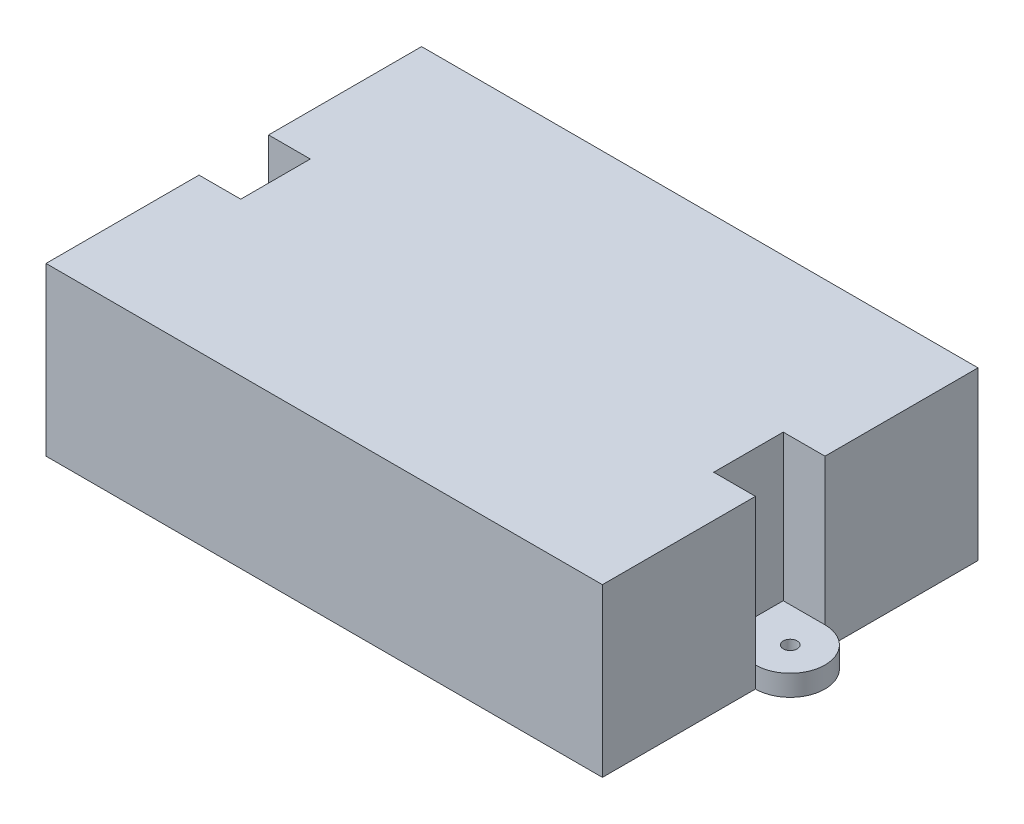
from build123d import *

# Parameters (mm, degrees)
SKETCH1_R           = 1
BOSS_EXTRUDE1_DEPTH = 3
BOSS_EXTRUDE2_DEPTH = 21


with BuildPart() as part:
    # Sketch1 → Boss-Extrude1 (new body)
    with BuildSketch(Plane(origin=(0, 0, 0), x_dir=(1, 0, 0), z_dir=(0, 1, 0))):
        with BuildLine():
            Line((-40, 5), (-40, 27))
            Line((-40, 27), (40, 27))
            Line((40, 27), (40, 5))
            ThreePointArc((40, 5), (45, 0), (40, -5))
            Line((40, -5), (40, -27))
            Line((40, -27), (-40, -27))
            Line((-40, -27), (-40, -5))
            ThreePointArc((-40, -5), (-45, 0), (-40, 5))
        make_face()
        with Locations((-40, 0)):
            Circle(SKETCH1_R, mode=Mode.SUBTRACT)
        with Locations((40, 0)):
            Circle(SKETCH1_R, mode=Mode.SUBTRACT)
    extrude(amount=BOSS_EXTRUDE1_DEPTH)

    # Sketch2 → Boss-Extrude2 (add)
    with BuildSketch(Plane(origin=(0, 3, 0), x_dir=(1, 0, 0), z_dir=(0, 1, 0))):
        Polygon((-40, 5), (-34, 5), (-34, -5), (-40, -5), (-40, -27), (40, -27), (40, -5), (34, -5), (34, 5), (40, 5), (40, 27), (-40, 27), align=None)
    extrude(amount=BOSS_EXTRUDE2_DEPTH)


solid = part.part
